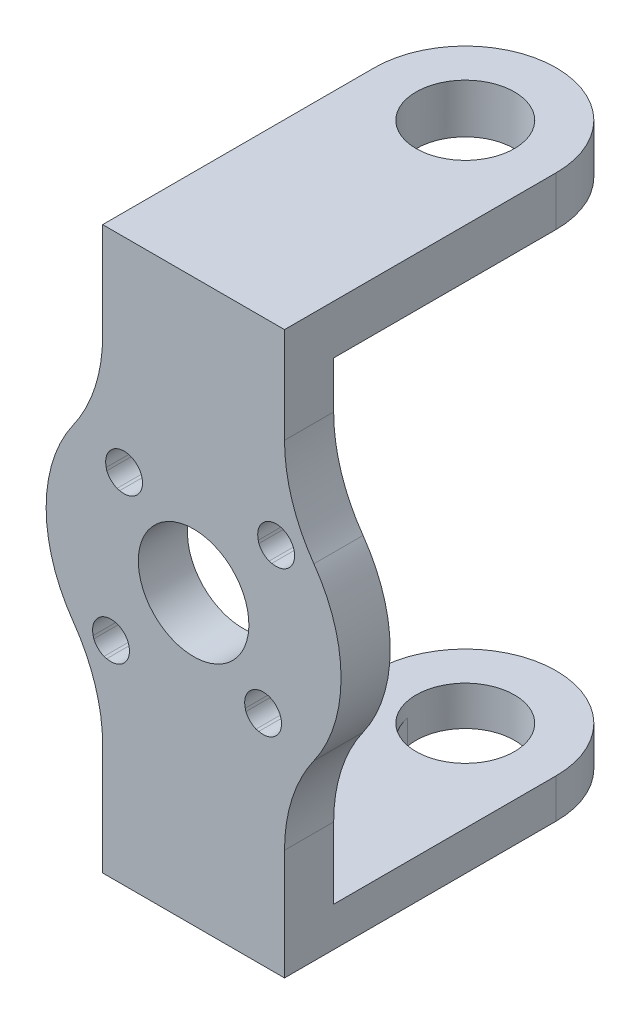
from build123d import *
from build123d.topology import SkipClean

# Parameters (mm, degrees)
BOSS_EXTRUDE1_OUTLINE_R = 4.5
BOSS_EXTRUDE1_DEPTH     = 4
BOSS_EXTRUDE2_START     = -2
BOSS_EXTRUDE2_DEPTH     = 1.2
BOSS_EXTRUDE3_DEPTH     = 2
BOSS_EXTRUDE4_DEPTH     = 2
BOSS_EXTRUDE5_DEPTH     = 2
CUT_EXTRUDE3_DEPTH      = 1.2
SKETCH12_R              = 4
CUT_EXTRUDE4_DEPTH      = 4
SKETCH8_R               = 1.5
CUT_EXTRUDE1_DEPTH      = 56.707591784
CUT_EXTRUDE2_START      = -15
SKETCH9_R               = 4
CUT_EXTRUDE2_DEPTH      = 15


# Read off the part's stored shape, not the designer's step: Boss-Extrude1
with BuildPart() as part:
    # Boss-Extrude1 outline → Boss-Extrude1 (new body)
    with BuildSketch(Plane(origin=(0, 0, 0), x_dir=(-1, 0, 0), z_dir=(0, 0, -1))):
        with BuildLine():
            Line((-7.4, 23.45), (-7.4, 14.446692543))
            ThreePointArc((-7.4, 14.446692543), (-8.012107067, 10.506844717), (-9.790721745, 6.938426891))
            ThreePointArc((-9.790721745, 6.938426891), (-12, 0), (-9.790721745, -6.938426891))
            ThreePointArc((-9.790721745, -6.938426891), (-8.012107067, -10.506844717), (-7.4, -14.446692543))
            Line((-7.4, -14.446692543), (-7.4, -23.45))
            Line((-7.4, -23.45), (7.4, -23.45))
            Line((7.4, -23.45), (7.4, -14.446692543))
            ThreePointArc((7.4, -14.446692543), (8.012107067, -10.506844717), (9.790721745, -6.938426891))
            ThreePointArc((9.790721745, -6.938426891), (12, 0), (9.790721745, 6.938426891))
            ThreePointArc((9.790721745, 6.938426891), (8.012107067, 10.506844717), (7.4, 14.446692543))
            Line((7.4, 14.446692543), (7.4, 23.45))
            Line((7.4, 23.45), (-7.4, 23.45))
        make_face()
        with BuildLine():
            add(Edge.make_bspline(
                [(-5.08661691, -7.066518716), (-5.158505421, -7.088491281), (-5.232048751, -7.104749218), (-5.306303966, -7.11531731)],
                knots=[0, 0, 0, 0, 0.301273824, 0.301273824, 0.301273824, 0.301273824], degree=3))
            ThreePointArc((-5.306303966, -7.11531731), (-6.708944151, -4.587692504), (-4.204222203, -6.030833041))
            add(Edge.make_bspline(
                [(-4.204222203, -6.030833041), (-4.215901752, -6.103480441), (-4.232873947, -6.175405229), (-4.255236782, -6.246594027)],
                knots=[0.717333192, 0.717333192, 0.717333192, 0.717333192, 1, 1, 1, 1], degree=3))
            add(Edge.make_bspline(
                [(-4.255236782, -6.246594027), (-4.333126561, -6.431712412), (-4.447649884, -6.599923699), (-4.729572884, -6.878207782), (-4.900435719, -6.991204718), (-5.08661691, -7.066518716)],
                knots=[0, 0, 0, 0, 0.5, 0.5, 1, 1, 1, 1], degree=3))
        make_face(mode=Mode.SUBTRACT)
        with BuildLine():
            add(Edge.make_bspline(
                [(7.28775176, -8.127178888), (7.215863249, -8.149151453), (7.14231992, -8.16540939), (7.068064705, -8.175977482)],
                knots=[0, 0, 0, 0, 0.301273824, 0.301273824, 0.301273824, 0.301273824], degree=3))
            ThreePointArc((7.068064705, -8.175977482), (5.665424519, -5.648352676), (8.170146468, -7.091493213))
            add(Edge.make_bspline(
                [(8.170146468, -7.091493213), (8.158466918, -7.164140613), (8.141494724, -7.236065401), (8.119131889, -7.307254199)],
                knots=[0.717333192, 0.717333192, 0.717333192, 0.717333192, 1, 1, 1, 1], degree=3))
            add(Edge.make_bspline(
                [(8.119131889, -7.307254199), (8.04124211, -7.492372584), (7.926718787, -7.66058387), (7.644795787, -7.938867954), (7.473932951, -8.05186489), (7.28775176, -8.127178888)],
                knots=[0, 0, 0, 0, 0.5, 0.5, 1, 1, 1, 1], degree=3))
        make_face(mode=Mode.SUBTRACT)
        with BuildLine():
            add(Edge.make_bspline(
                [(-6.147277082, 5.307849955), (-6.219165593, 5.28587739), (-6.292708922, 5.269619453), (-6.366964138, 5.259051361)],
                knots=[0, 0, 0, 0, 0.301273824, 0.301273824, 0.301273824, 0.301273824], degree=3))
            ThreePointArc((-6.366964138, 5.259051361), (-7.769604322, 7.786676168), (-5.264882374, 6.34353563))
            add(Edge.make_bspline(
                [(-5.264882374, 6.34353563), (-5.276561924, 6.27088823), (-5.293534119, 6.198963441), (-5.315896954, 6.127774644)],
                knots=[0.717333192, 0.717333192, 0.717333192, 0.717333192, 1, 1, 1, 1], degree=3))
            add(Edge.make_bspline(
                [(-5.315896954, 6.127774644), (-5.393786733, 5.942656259), (-5.508310056, 5.774444972), (-5.790233055, 5.496160889), (-5.961095891, 5.383163953), (-6.147277082, 5.307849955)],
                knots=[0, 0, 0, 0, 0.5, 0.5, 1, 1, 1, 1], degree=3))
        make_face(mode=Mode.SUBTRACT)
        Circle(BOSS_EXTRUDE1_OUTLINE_R, mode=Mode.SUBTRACT)
        with BuildLine():
            add(Edge.make_bspline(
                [(6.227091589, 4.247189783), (6.155203078, 4.225217218), (6.081659748, 4.208959281), (6.007404533, 4.198391189)],
                knots=[0, 0, 0, 0, 0.301273824, 0.301273824, 0.301273824, 0.301273824], degree=3))
            ThreePointArc((6.007404533, 4.198391189), (4.604764348, 6.726015995), (7.109486296, 5.282875458))
            add(Edge.make_bspline(
                [(7.109486296, 5.282875458), (7.097806747, 5.210228058), (7.080834552, 5.13830327), (7.058471717, 5.067114472)],
                knots=[0.717333192, 0.717333192, 0.717333192, 0.717333192, 1, 1, 1, 1], degree=3))
            add(Edge.make_bspline(
                [(7.058471717, 5.067114472), (6.980581938, 4.881996087), (6.866058615, 4.7137848), (6.584135615, 4.435500717), (6.41327278, 4.322503781), (6.227091589, 4.247189783)],
                knots=[0, 0, 0, 0, 0.5, 0.5, 1, 1, 1, 1], degree=3))
        make_face(mode=Mode.SUBTRACT)
    extrude(amount=BOSS_EXTRUDE1_DEPTH)

    # Sketch4 → Boss-Extrude2 (add)
    with BuildSketch(Plane(origin=(0, -23.45, 0), x_dir=(-1, 0, 0), z_dir=(0, -1, 0)).offset(BOSS_EXTRUDE2_START)):
        with BuildLine():
            Line((-7.4, 4), (-7.4, 22.110096084))
            ThreePointArc((-7.4, 22.110096084), (0, 29.510096084), (7.4, 22.110096084))
            Line((7.4, 22.110096084), (7.4, 4))
            Line((7.4, 4), (-7.4, 4))
        make_face()
    boss_extrude2 = extrude(amount=-BOSS_EXTRUDE2_DEPTH)

    # Mirror1: Boss-Extrude2 across plane
    add(boss_extrude2.mirror(Plane.ZX))

    # Sketch6 → Boss-Extrude3 (add)
    with BuildSketch(Plane.XZ.offset(21.45)):
        with BuildLine():
            ThreePointArc((-7.4, -22.110096084), (0, -29.510096084), (7.4, -22.110096084))
            Line((7.4, -22.110096084), (7.4, -4))
            Line((7.4, -4), (-7.4, -4))
            Line((-7.4, -4), (-7.4, -22.110096084))
        make_face()
        with BuildLine():
            Line((-3.920792079, -21.318016876), (-2.5, -7.110096084))
            ThreePointArc((-2.5, -7.110096084), (0, -4.610096084), (2.5, -7.110096084))
            Line((2.5, -7.110096084), (3.920792079, -21.318016876))
            ThreePointArc((3.920792079, -21.318016876), (3.980148761, -21.712081207), (4, -22.110096084))
            ThreePointArc((4, -22.110096084), (0, -26.110096084), (-4, -22.110096084))
            ThreePointArc((-4, -22.110096084), (-3.980148761, -21.712081207), (-3.920792079, -21.318016876))
        make_face(mode=Mode.SUBTRACT)
    extrude(amount=BOSS_EXTRUDE3_DEPTH)

    # Sketch7 → Boss-Extrude4 (add)
    with BuildSketch(Plane(origin=(0, 21.45, 0), x_dir=(1, 0, 0), z_dir=(0, 1, 0))):
        with BuildLine():
            Line((-7.4, 22.110096084), (-7.4, 4))
            Line((-7.4, 4), (7.4, 4))
            Line((7.4, 4), (7.4, 22.110096084))
            ThreePointArc((7.4, 22.110096084), (0, 29.510096084), (-7.4, 22.110096084))
        make_face()
    extrude(amount=BOSS_EXTRUDE4_DEPTH)

    # Sketch10 → Boss-Extrude5 (add)
    with BuildSketch(Plane.XZ.offset(-20.25)):
        with BuildLine():
            Line((7.4, -4), (-7.4, -4))
            Line((-7.4, -4), (-7.4, -22.110096084))
            ThreePointArc((-7.4, -22.110096084), (0, -29.510096084), (7.4, -22.110096084))
            Line((7.4, -22.110096084), (7.4, -4))
        make_face()
    extrude(amount=BOSS_EXTRUDE5_DEPTH)

    # Sketch11 → Cut-Extrude3 (cut)
    with BuildSketch(Plane(origin=(0, 23.45, 0), x_dir=(1, 0, 0), z_dir=(0, 1, 0))):
        with BuildLine():
            Line((-7.4, 0), (7.4, 0))
            Line((7.4, 0), (7.4, 22.110096084))
            ThreePointArc((7.4, 22.110096084), (0, 29.510096084), (-7.4, 22.110096084))
            Line((-7.4, 22.110096084), (-7.4, 0))
        make_face()
    extrude(amount=-CUT_EXTRUDE3_DEPTH, mode=Mode.SUBTRACT)

    # Sketch12 → Cut-Extrude4 (cut)
    with BuildSketch(Plane(origin=(0, 22.25, 0), x_dir=(1, 0, 0), z_dir=(0, 1, 0))):
        with Locations(Location((0, 22.110096084, 0), (0, 0, 270))):
            Circle(SKETCH12_R)
    extrude(amount=-CUT_EXTRUDE4_DEPTH, mode=Mode.SUBTRACT)

    # Sketch8 → Cut-Extrude1 (cut, through all)
    with BuildSketch(Plane.XZ.offset(23.45)):
        with Locations(Location((0, -22.110096084, 0), (0, 0, 270))):
            Circle(SKETCH8_R)
    extrude(amount=-CUT_EXTRUDE1_DEPTH, mode=Mode.SUBTRACT)

    # Sketch9 → Cut-Extrude2 (cut)
    with SkipClean():  # the faces are left unmerged after this step: merging them gives an invalid solid
        with BuildSketch(Plane.XZ.offset(23.45).offset(CUT_EXTRUDE2_START)):
            with Locations(Location((0, -22.110096084, 0), (0, 0, 11.421186275))):
                Circle(SKETCH9_R)
        extrude(amount=CUT_EXTRUDE2_DEPTH, mode=Mode.SUBTRACT)


solid = part.part
